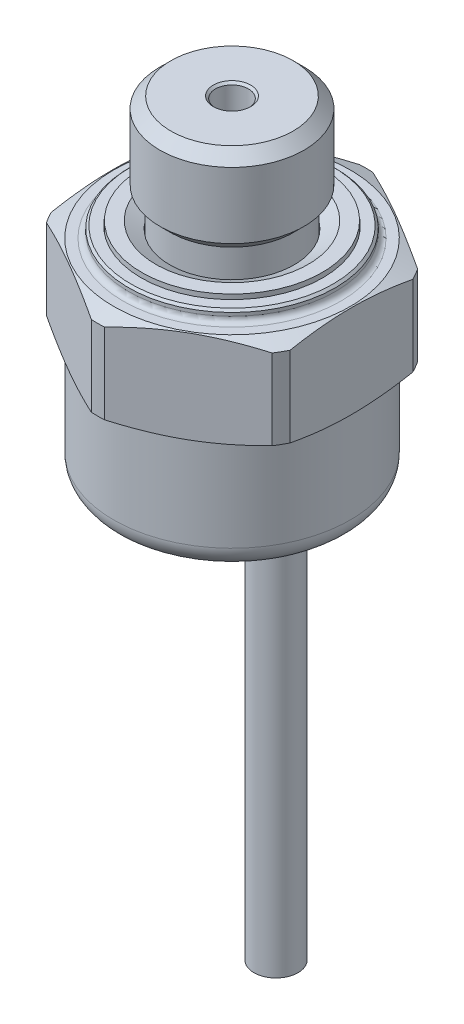
from build123d import *

# Parameters (mm, degrees)
CUT_EXTRUDE2_DEPTH  = 36.477880433
FILLET1_R           = 2
CHAMFER1_SIZE       = 1
CHAMFER2_SIZE       = 0.2
FILLET2_R           = 0.5
BOSS_EXTRUDE1_START = -20
SKETCH5_R           = 2
BOSS_EXTRUDE1_DEPTH = 50


# Some blends are built 0.0001 mm under size
with BuildPart() as part:
    # Sketch1 → Revolve1 (revolve)
    with BuildSketch(Plane.XY, mode=Mode.PRIVATE) as revolve1_sk:
        with BuildLine():
            Line((10.75, -30), (10.75, -19.7))
            Line((10.75, -19.7), (12.2, -19.099390335))
            Line((12.2, -19.099390335), (12.2, -11.800609665))
            Line((12.2, -11.800609665), (10.75, -11.2))
            Line((10.75, -11.2), (9.4, -11.2))
            Line((9.4, -11.2), (9.4, -10.2))
            Line((9.4, -10.2), (8.25, -10.2))
            Line((8.25, -10.2), (8.25, -11.2))
            Line((8.25, -11.2), (5.6, -11.2))
            Line((5.6, -11.2), (5.6, -8))
            Line((5.6, -8), (6.55, -8))
            Line((6.55, -8), (6.55, 0))
            Line((6.55, 0), (1.5, 0))
            Line((1.5, 0), (1.5, -10))
            Line((1.5, -10), (0, -10))
            Line((0, -10), (0, -31))
            ThreePointArc((0, -31), (4.403478738, -30.749188961), (8.75, -30))
            Line((8.75, -30), (10.75, -30))
        make_face()
        Polygon((5.65, -11.15), (8.2, -11.15), (8.2, -9.8), (6.925, -9.8), (5.65, -10.475), align=None)
    revolve(revolve1_sk.sketch.rotate(Axis((0, 0, 0), (0, -1, 0)), 180), axis=Axis((0, 0, 0), (0, -1, 0)))

    # Sketch2 → Cut-Extrude2 (cut, through all)
    with BuildSketch(Plane(origin=(0, 0, 0), x_dir=(1, 0, 0), z_dir=(0, 1, 0))):
        with BuildLine():
            Line((-10.255954875, 6.607222534), (-0.594045125, 12.185528728))
            ThreePointArc((-0.594045125, 12.185528728), (-6.1, 10.565509926), (-10.255954875, 6.607222534))
        make_face()
        with BuildLine():
            ThreePointArc((10.255954875, 6.607222534), (6.1, 10.565509926), (0.594045125, 12.185528728))
            Line((0.594045125, 12.185528728), (10.255954875, 6.607222534))
        make_face()
        with BuildLine():
            ThreePointArc((12.2, 0), (11.857697922, 2.86966897), (10.85, 5.578306195))
            Line((10.85, 5.578306195), (10.85, -5.578306195))
            ThreePointArc((10.85, -5.578306195), (11.857697922, -2.86966897), (12.2, 0))
        make_face()
        with BuildLine():
            ThreePointArc((0.594045125, -12.185528728), (6.1, -10.565509926), (10.255954875, -6.607222534))
            Line((10.255954875, -6.607222534), (0.594045125, -12.185528728))
        make_face()
        with BuildLine():
            Line((-0.594045125, -12.185528728), (-10.255954875, -6.607222534))
            ThreePointArc((-10.255954875, -6.607222534), (-6.1, -10.565509926), (-0.594045125, -12.185528728))
        make_face()
        with BuildLine():
            Line((-10.85, -5.578306195), (-10.85, 5.578306195))
            ThreePointArc((-10.85, 5.578306195), (-12.2, 0), (-10.85, -5.578306195))
        make_face()
    extrude(amount=-CUT_EXTRUDE2_DEPTH, mode=Mode.SUBTRACT)

    # Fillet1
    fillet1_edges = [part.edges().sort_by_distance(p)[0] for p in [
        (10.75, -30, 0),
    ]]
    fillet(fillet1_edges, radius=FILLET1_R - 0.0001)  # a hair under: the kernel refuses the full size

    # Chamfer1
    # the kernel refuses this chamfer: 1 mm, written as the material it takes off along each edge
    with BuildSketch(Plane(origin=(0, -8, 0), x_dir=(-1, 0, 0), z_dir=(0, 0, 1))) as chamfer1_piece_1_section:
        Polygon((6.55 - CHAMFER1_SIZE, 0), (6.55, -CHAMFER1_SIZE), (6.55, 0), align=None)
    chamfer1_piece_1 = revolve(axis=Axis((0, -8, 0), (0, -1, 0)), mode=Mode.PRIVATE)
    chamfer1_piece_1 = chamfer1_piece_1 - Plane(origin=(0, -7.480474421, 0), x_dir=(-1, 0, 0), z_dir=(0, 1, 0)) * Cylinder(5.6, 27, mode=Mode.PRIVATE)
    add(chamfer1_piece_1, mode=Mode.SUBTRACT)
    with BuildSketch(Plane(origin=(0, 0, 0), x_dir=(-1, 0, 0), z_dir=(0, 0, 1))) as chamfer1_piece_2:
        Polygon((6.55, CHAMFER1_SIZE), (6.55 - CHAMFER1_SIZE, 0), (6.55, 0), align=None)
    revolve(axis=Axis((0, 0, 0), (0, -1, 0)), mode=Mode.SUBTRACT)

    # Chamfer2
    chamfer2_edges = [part.edges().sort_by_distance(p)[0] for p in [
        (9.4, -10.2, 0),
        (1.5, 0, 0),
        (1.5, -10, 0),
    ]]
    chamfer(chamfer2_edges, length=CHAMFER2_SIZE)

    # Fillet2
    fillet2_edges = [part.edges().sort_by_distance(p)[0] for p in [
        (9.4, -11.2, 0),
    ]]
    fillet(fillet2_edges, radius=FILLET2_R)


with BuildPart() as body_2:
    # Sketch5 → Boss-Extrude1 (new body)
    with BuildSketch(Plane(origin=(0, 0, 0), x_dir=(1, 0, 0), z_dir=(0, 1, 0)).offset(BOSS_EXTRUDE1_START)):
        with Locations(Location((0, 4, 0), (0, 0, 270))):
            Circle(SKETCH5_R)
    extrude(amount=-BOSS_EXTRUDE1_DEPTH)


solid = Compound([part.part, body_2.part])
